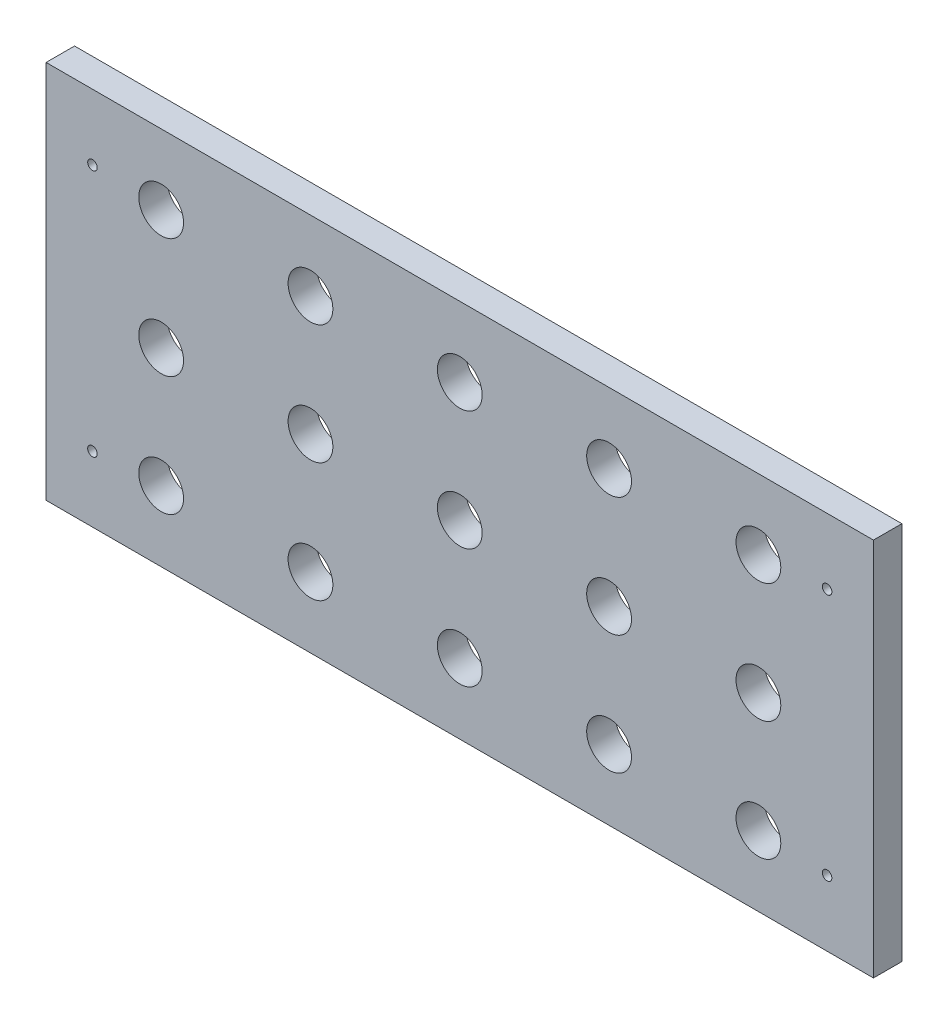
from build123d import *

# Parameters (mm, degrees)
SKETCH1_W           = 277.05
SKETCH1_H           = 127
SKETCH1_R           = 1.6
WALL_DEPTH          = 9.525
CANNULUSHOLES_REACH = 306.92
SKETCH4_R           = 7.5


with BuildPart() as part:
    # Sketch1 → Wall (new body)
    with BuildSketch(Plane.XY):
        with Locations((138.525, 63.5)):
            Rectangle(SKETCH1_W, SKETCH1_H)
        with Locations((15.525, 105)):
            Circle(SKETCH1_R, mode=Mode.SUBTRACT)
        with Locations((15.525, 22)):
            Circle(SKETCH1_R, mode=Mode.SUBTRACT)
        with Locations((261.525, 105)):
            Circle(SKETCH1_R, mode=Mode.SUBTRACT)
        with Locations((261.525, 22)):
            Circle(SKETCH1_R, mode=Mode.SUBTRACT)
    extrude(amount=WALL_DEPTH)

    # Sketch4 → CannulusHoles (cut, up to next)
    with BuildSketch(Plane.XY.offset(9.525), mode=Mode.PRIVATE) as cannulusholes_sk1:
        with Locations((38.525, 103.5)):
            Circle(SKETCH4_R)
    cannulusholes_tool1 = extrude(cannulusholes_sk1.sketch, amount=-CANNULUSHOLES_REACH, mode=Mode.PRIVATE) & part.part
    # Sketch4 → CannulusHoles (cut, up to next)
    with BuildSketch(Plane.XY.offset(9.525), mode=Mode.PRIVATE) as cannulusholes_sk2:
        with Locations((38.525, 63.5)):
            Circle(SKETCH4_R)
    cannulusholes_tool2 = extrude(cannulusholes_sk2.sketch, amount=-CANNULUSHOLES_REACH, mode=Mode.PRIVATE) & part.part
    # Sketch4 → CannulusHoles (cut, up to next)
    with BuildSketch(Plane.XY.offset(9.525), mode=Mode.PRIVATE) as cannulusholes_sk3:
        with Locations((88.525, 63.5)):
            Circle(SKETCH4_R)
    cannulusholes_tool3 = extrude(cannulusholes_sk3.sketch, amount=-CANNULUSHOLES_REACH, mode=Mode.PRIVATE) & part.part
    # Sketch4 → CannulusHoles (cut, up to next)
    with BuildSketch(Plane.XY.offset(9.525), mode=Mode.PRIVATE) as cannulusholes_sk4:
        with Locations((138.525, 63.5)):
            Circle(SKETCH4_R)
    cannulusholes_tool4 = extrude(cannulusholes_sk4.sketch, amount=-CANNULUSHOLES_REACH, mode=Mode.PRIVATE) & part.part
    # Sketch4 → CannulusHoles (cut, up to next)
    with BuildSketch(Plane.XY.offset(9.525), mode=Mode.PRIVATE) as cannulusholes_sk5:
        with Locations((88.525, 103.5)):
            Circle(SKETCH4_R)
    cannulusholes_tool5 = extrude(cannulusholes_sk5.sketch, amount=-CANNULUSHOLES_REACH, mode=Mode.PRIVATE) & part.part
    # Sketch4 → CannulusHoles (cut, up to next)
    with BuildSketch(Plane.XY.offset(9.525), mode=Mode.PRIVATE) as cannulusholes_sk6:
        with Locations((138.525, 103.5)):
            Circle(SKETCH4_R)
    cannulusholes_tool6 = extrude(cannulusholes_sk6.sketch, amount=-CANNULUSHOLES_REACH, mode=Mode.PRIVATE) & part.part
    # Sketch4 → CannulusHoles (cut, up to next)
    with BuildSketch(Plane.XY.offset(9.525), mode=Mode.PRIVATE) as cannulusholes_sk7:
        with Locations((188.525, 103.5)):
            Circle(SKETCH4_R)
    cannulusholes_tool7 = extrude(cannulusholes_sk7.sketch, amount=-CANNULUSHOLES_REACH, mode=Mode.PRIVATE) & part.part
    # Sketch4 → CannulusHoles (cut, up to next)
    with BuildSketch(Plane.XY.offset(9.525), mode=Mode.PRIVATE) as cannulusholes_sk8:
        with Locations((238.525, 103.5)):
            Circle(SKETCH4_R)
    cannulusholes_tool8 = extrude(cannulusholes_sk8.sketch, amount=-CANNULUSHOLES_REACH, mode=Mode.PRIVATE) & part.part
    # Sketch4 → CannulusHoles (cut, up to next)
    with BuildSketch(Plane.XY.offset(9.525), mode=Mode.PRIVATE) as cannulusholes_sk9:
        with Locations((188.525, 63.5)):
            Circle(SKETCH4_R)
    cannulusholes_tool9 = extrude(cannulusholes_sk9.sketch, amount=-CANNULUSHOLES_REACH, mode=Mode.PRIVATE) & part.part
    # Sketch4 → CannulusHoles (cut, up to next)
    with BuildSketch(Plane.XY.offset(9.525), mode=Mode.PRIVATE) as cannulusholes_sk10:
        with Locations((238.525, 63.5)):
            Circle(SKETCH4_R)
    cannulusholes_tool10 = extrude(cannulusholes_sk10.sketch, amount=-CANNULUSHOLES_REACH, mode=Mode.PRIVATE) & part.part
    # Sketch4 → CannulusHoles (cut, up to next)
    with BuildSketch(Plane.XY.offset(9.525), mode=Mode.PRIVATE) as cannulusholes_sk11:
        with Locations((38.525, 23.5)):
            Circle(SKETCH4_R)
    cannulusholes_tool11 = extrude(cannulusholes_sk11.sketch, amount=-CANNULUSHOLES_REACH, mode=Mode.PRIVATE) & part.part
    # Sketch4 → CannulusHoles (cut, up to next)
    with BuildSketch(Plane.XY.offset(9.525), mode=Mode.PRIVATE) as cannulusholes_sk12:
        with Locations((88.525, 23.5)):
            Circle(SKETCH4_R)
    cannulusholes_tool12 = extrude(cannulusholes_sk12.sketch, amount=-CANNULUSHOLES_REACH, mode=Mode.PRIVATE) & part.part
    # Sketch4 → CannulusHoles (cut, up to next)
    with BuildSketch(Plane.XY.offset(9.525), mode=Mode.PRIVATE) as cannulusholes_sk13:
        with Locations((138.525, 23.5)):
            Circle(SKETCH4_R)
    cannulusholes_tool13 = extrude(cannulusholes_sk13.sketch, amount=-CANNULUSHOLES_REACH, mode=Mode.PRIVATE) & part.part
    # Sketch4 → CannulusHoles (cut, up to next)
    with BuildSketch(Plane.XY.offset(9.525), mode=Mode.PRIVATE) as cannulusholes_sk14:
        with Locations((188.525, 23.5)):
            Circle(SKETCH4_R)
    cannulusholes_tool14 = extrude(cannulusholes_sk14.sketch, amount=-CANNULUSHOLES_REACH, mode=Mode.PRIVATE) & part.part
    # Sketch4 → CannulusHoles (cut, up to next)
    with BuildSketch(Plane.XY.offset(9.525), mode=Mode.PRIVATE) as cannulusholes_sk15:
        with Locations((238.525, 23.5)):
            Circle(SKETCH4_R)
    cannulusholes_tool15 = extrude(cannulusholes_sk15.sketch, amount=-CANNULUSHOLES_REACH, mode=Mode.PRIVATE) & part.part
    add(cannulusholes_tool1.solids().sort_by_distance((38.525, 103.5, 9.525))[0], mode=Mode.SUBTRACT)
    add(cannulusholes_tool2.solids().sort_by_distance((38.525, 63.5, 9.525))[0], mode=Mode.SUBTRACT)
    add(cannulusholes_tool3.solids().sort_by_distance((88.525, 63.5, 9.525))[0], mode=Mode.SUBTRACT)
    add(cannulusholes_tool4.solids().sort_by_distance((138.525, 63.5, 9.525))[0], mode=Mode.SUBTRACT)
    add(cannulusholes_tool5.solids().sort_by_distance((88.525, 103.5, 9.525))[0], mode=Mode.SUBTRACT)
    add(cannulusholes_tool6.solids().sort_by_distance((138.525, 103.5, 9.525))[0], mode=Mode.SUBTRACT)
    add(cannulusholes_tool7.solids().sort_by_distance((188.525, 103.5, 9.525))[0], mode=Mode.SUBTRACT)
    add(cannulusholes_tool8.solids().sort_by_distance((238.525, 103.5, 9.525))[0], mode=Mode.SUBTRACT)
    add(cannulusholes_tool9.solids().sort_by_distance((188.525, 63.5, 9.525))[0], mode=Mode.SUBTRACT)
    add(cannulusholes_tool10.solids().sort_by_distance((238.525, 63.5, 9.525))[0], mode=Mode.SUBTRACT)
    add(cannulusholes_tool11.solids().sort_by_distance((38.525, 23.5, 9.525))[0], mode=Mode.SUBTRACT)
    add(cannulusholes_tool12.solids().sort_by_distance((88.525, 23.5, 9.525))[0], mode=Mode.SUBTRACT)
    add(cannulusholes_tool13.solids().sort_by_distance((138.525, 23.5, 9.525))[0], mode=Mode.SUBTRACT)
    add(cannulusholes_tool14.solids().sort_by_distance((188.525, 23.5, 9.525))[0], mode=Mode.SUBTRACT)
    add(cannulusholes_tool15.solids().sort_by_distance((238.525, 23.5, 9.525))[0], mode=Mode.SUBTRACT)


solid = part.part
